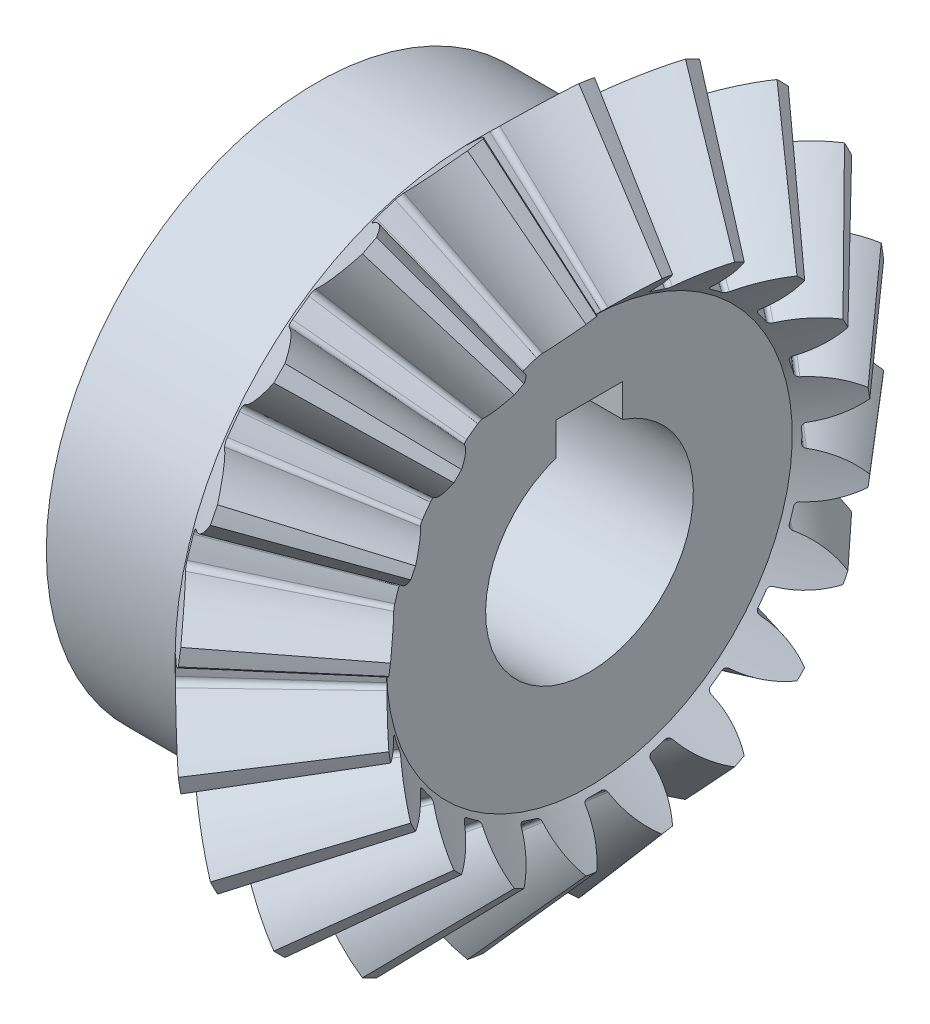
from build123d import *

# Parameters (mm, degrees)
TEETHCUTS_COUNT    = 20
TEETHCUTS_ANGLE    = 342
HUBSKE_R           = 32.5
HUB_DEPTH          = 20.799003436
BORSKE_R           = 12.5
BORE_DEPTH         = 65.0000508
KEYSKE_W           = 8
KEYSKE_H           = 15.8
KEYWAY_DEPTH       = 65.0000508
CUT_EXTRUDE1_START = -2
SKETCH1_R          = 32.5
SKETCH1_R_2        = 18
CUT_EXTRUDE1_DEPTH = 2


with BuildPart() as part:
    # BasProSke → Base-Revolve (revolve)
    with BuildSketch(Plane(origin=(0, 0, 0), x_dir=(1, 0, 0), z_dir=(0, 1, 0)), mode=Mode.PRIVATE) as base_revolve_sk:
        Polygon((0, 0), (0, 35.79890184), (7.029525295, 42.828427122), (18.857447343, 29.200505049), (14.064703302, 24.407761017), (14.064703302, 0), align=None)
    revolve(base_revolve_sk.sketch.rotate(Axis((-10, 0, 0), (1, 0, 0)), 180), axis=Axis((-10, 0, 0), (1, 0, 0)))

    # ToothCut: read off the stored shape, not the designer's step
    # ToothCut: loft between two sections, ruled curve by curve
    toothcut_from = [
        Edge.make_bspline([(44.207145713, 0.006047546, -0.009388477), (44.202916967, 0.0018188, -0.014836366), (44.197225398, -0.003872769, -0.01402633), (44.193849029, -0.007249138, -0.007496068)], [0, 0, 0, 0, 1, 1, 1, 1], 3, [1, 0.77873572, 0.77873572, 1]),
        Edge.make_bspline([(44.193849029, -0.007249138, 0.007496068), (44.197225398, -0.003872769, 0.01402633), (44.202916967, 0.0018188, 0.014836366), (44.207145713, 0.006047546, 0.009388477)], [0, 0, 0, 0, 1, 1, 1, 1], 3, [1, 0.77873572, 0.77873572, 1]),
        Edge.make_bspline([(44.193849029, -0.007249138, -0.007496068), (44.193350411, -0.007747756, -0.006531687), (44.192952305, -0.008145863, -0.005477982), (44.192662572, -0.008435596, -0.004355761)], [0, 0, 0, 0, 1, 1, 1, 1], 3, [1, 0.993417768, 0.993417768, 1]),
        Edge.make_bspline([(44.192662572, -0.008435596, 0.004355761), (44.192952305, -0.008145863, 0.005477982), (44.193350411, -0.007747756, 0.006531687), (44.193849029, -0.007249138, 0.007496068)], [0, 0, 0, 0, 1, 1, 1, 1], 3, [1, 0.993417768, 0.993417768, 1]),
        Edge.make_bspline([(44.192662572, -0.008435596, -0.004355761), (44.191928659, -0.009169509, -0.001513105), (44.191928659, -0.009169509, 0.001513105), (44.192662572, -0.008435596, 0.004355761)], [0, 0, 0, 0, 1, 1, 1, 1], 3, [1, 0.959563429, 0.959563429, 1]),
        Edge.make_line((44.207145713, 0.006047546, 0.009388477), (44.207145713, 0.006047546, -0.009388477)),
    ]
    toothcut_to = [
        Edge.make_bspline([(7.32554149, 43.124443317, -6.418699125), (5.663005764, 41.461907594, -4.077551166), (3.578812717, 39.377714551, -2.553969025), (1.266823435, 37.065725272, -1.989668599)], [0, 0, 0, 0, 1, 1, 1, 1], 3, [1, 0.968995021, 0.968995021, 1]),
        Edge.make_bspline([(1.266823435, 37.065725272, 1.989668599), (3.578812717, 39.377714551, 2.553969025), (5.663005764, 41.461907594, 4.077551166), (7.32554149, 43.124443317, 6.418699125)], [0, 0, 0, 0, 1, 1, 1, 1], 3, [1, 0.968995021, 0.968995021, 1]),
        Edge.make_bspline([(1.266823435, 37.065725272, -1.989668599), (0.991695027, 36.790596865, -1.922516437), (0.815571627, 36.614473465, -1.616147721), (0.825247616, 36.624149454, -1.221542292)], [0, 0, 0, 0, 1, 1, 1, 1], 3, [1, 0.835731877, 0.835731877, 1]),
        Edge.make_bspline([(0.825247616, 36.624149454, 1.221542292), (0.815571627, 36.614473465, 1.616147721), (0.991695027, 36.790596865, 1.922516437), (1.266823435, 37.065725272, 1.989668599)], [0, 0, 0, 0, 1, 1, 1, 1], 3, [1, 0.835731877, 0.835731877, 1]),
        Edge.make_bspline([(0.825247616, 36.624149454, -1.221542292), (0.845212305, 36.644114144, -0.407343897), (0.845212305, 36.644114144, 0.407343897), (0.825247616, 36.624149454, 1.221542292)], [0, 0, 0, 0, 1, 1, 1, 1], 3, [1, 0.999599519, 0.999599519, 1]),
        Edge.make_line((7.32554149, 43.124443317, 6.418699125), (7.32554149, 43.124443317, -6.418699125)),
    ]
    toothcut = Solid(Shell([*[Face.make_surface_from_curves(toothcut_from[k], toothcut_to[k]) for k in range(6)], Face(Wire(toothcut_from)), Face(Wire(toothcut_to))]))
    add(toothcut, mode=Mode.SUBTRACT)

    # TeethCuts: ToothCut ×20 about axis
    teethcuts_axis = Axis((-10, 0, 0), (1, 0, 0))
    for i in range(1, TEETHCUTS_COUNT):
        add(toothcut.rotate(teethcuts_axis, i * TEETHCUTS_ANGLE / (TEETHCUTS_COUNT - 1)), mode=Mode.SUBTRACT)

    # HubSke → Hub (add)
    with BuildSketch(Plane.ZY):
        with Locations(Location((0, 0, 0), (0, 0, 180))):
            Circle(HUBSKE_R)
    extrude(amount=HUB_DEPTH)

    # BorSke → Bore (cut, symmetric)
    with BuildSketch(Plane(origin=(0, 0, 0), x_dir=(0, 0, -1), z_dir=(1, 0, 0))):
        with Locations(Location((0, 0, 0), (0, 0, 180))):
            Circle(BORSKE_R)
    extrude(amount=BORE_DEPTH, both=True, mode=Mode.SUBTRACT)

    # KeySke → Keyway (cut, symmetric)
    with BuildSketch(Plane(origin=(0, 0, 0), x_dir=(0, 0, -1), z_dir=(1, 0, 0))):
        with Locations((0, 7.9)):
            Rectangle(KEYSKE_W, KEYSKE_H)
    extrude(amount=KEYWAY_DEPTH, both=True, mode=Mode.SUBTRACT)

    # Sketch1 → Cut-Extrude1 (cut)
    with BuildSketch(Plane.ZY.offset(20.799003436).offset(CUT_EXTRUDE1_START)):
        with Locations(Location((0, 0, 0), (0, 0, 180))):
            Circle(SKETCH1_R)
        Circle(SKETCH1_R_2, mode=Mode.SUBTRACT)
    extrude(amount=CUT_EXTRUDE1_DEPTH, mode=Mode.SUBTRACT)


solid = part.part
